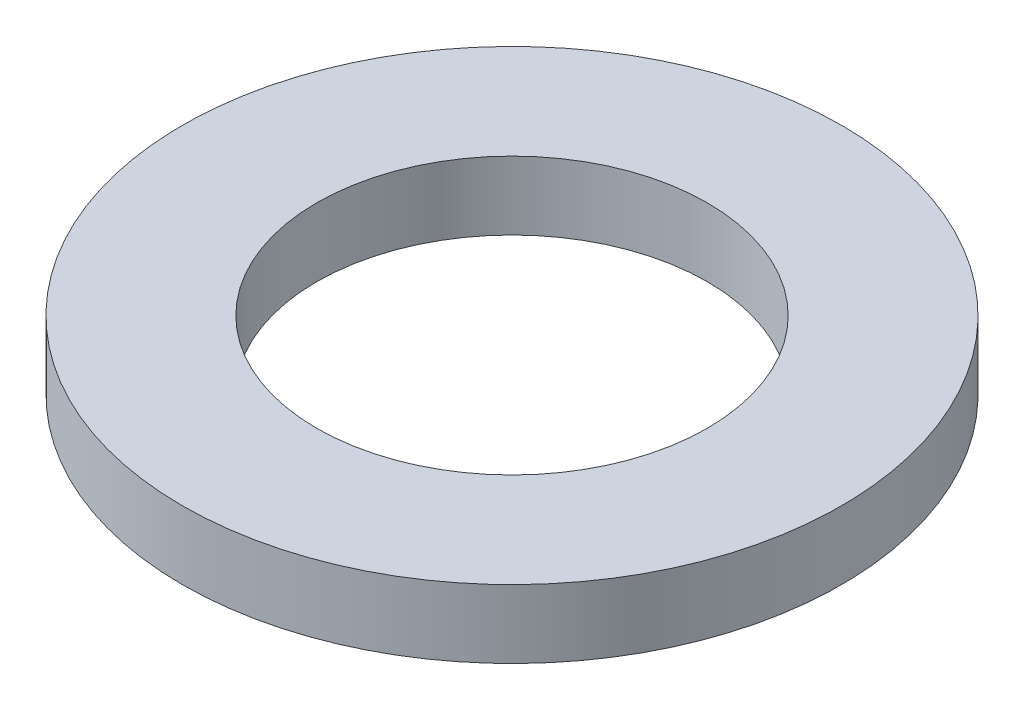
from build123d import *

# Parameters (mm, degrees)
SKETCH1_R           = 67.5
BOSS_EXTRUDE1_DEPTH = 14
SKETCH2_R           = 40
CUT_EXTRUDE1_DEPTH  = 97.480567992


with BuildPart() as part:
    # Sketch1 → Boss-Extrude1 (new body)
    with BuildSketch(Plane(origin=(0, 0, 0), x_dir=(1, 0, 0), z_dir=(0, 1, 0))):
        Circle(SKETCH1_R)
    extrude(amount=BOSS_EXTRUDE1_DEPTH)

    # Sketch2 → Cut-Extrude1 (cut, through all)
    with BuildSketch(Plane(origin=(0, 0, 0), x_dir=(1, 0, 0), z_dir=(0, 1, 0))):
        Circle(SKETCH2_R)
    extrude(amount=CUT_EXTRUDE1_DEPTH, mode=Mode.SUBTRACT)


solid = part.part
